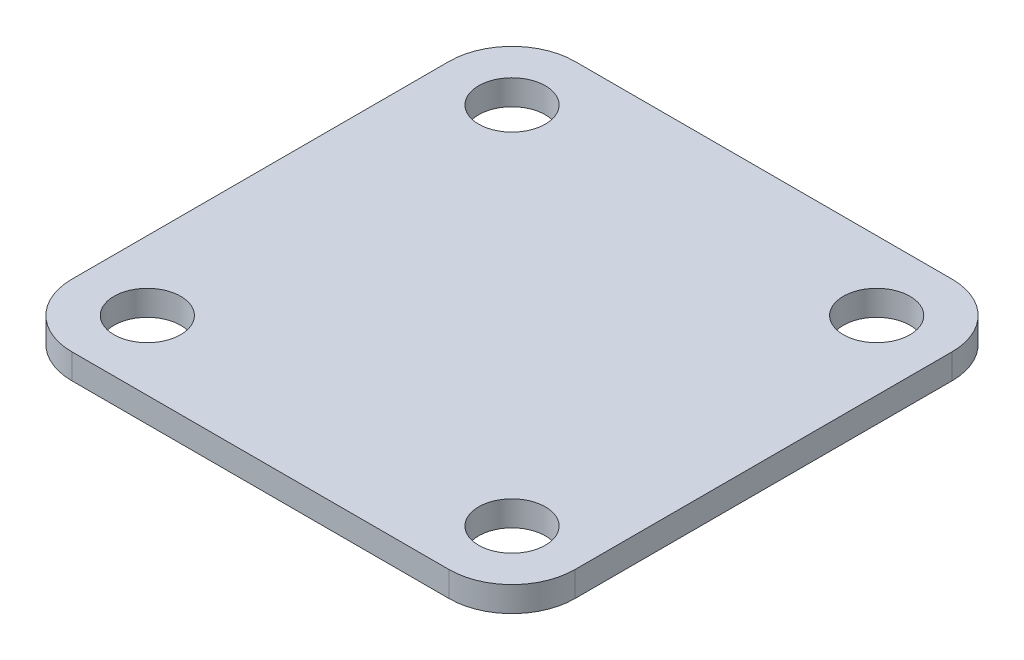
from build123d import *

# Parameters (mm, degrees)
SKETCH1_R           = 2.65
BOSS_EXTRUDE1_DEPTH = 2
SKETCH4_R           = 15
BOSS_EXTRUDE2_DEPTH = 3
FILLET1_R           = 2
FILLET2_R           = 1


# Read off the part's stored shape, not the designer's step: Shell2
with BuildPart() as part:
    # Sketch1 → Boss-Extrude1 (new body)
    with BuildSketch(Plane(origin=(0, 0, 0), x_dir=(1, 0, 0), z_dir=(0, 1, 0))):
        with BuildLine():
            Line((5, 0), (35, 0))
            ThreePointArc((35, 0), (38.535533906, 1.464466094), (40, 5))
            Line((40, 5), (40, 35))
            ThreePointArc((40, 35), (38.535533906, 38.535533906), (35, 40))
            Line((35, 40), (5, 40))
            ThreePointArc((5, 40), (1.464466094, 38.535533906), (0, 35))
            Line((0, 35), (0, 5))
            ThreePointArc((0, 5), (1.464466094, 1.464466094), (5, 0))
        make_face()
        with Locations(Location((5.5, 34.5, 0), (0, 0, 270))):
            Circle(SKETCH1_R, mode=Mode.SUBTRACT)
        with Locations(Location((34.5, 34.5, 0), (0, 0, 270))):
            Circle(SKETCH1_R, mode=Mode.SUBTRACT)
        with Locations(Location((34.5, 5.5, 0), (0, 0, 270))):
            Circle(SKETCH1_R, mode=Mode.SUBTRACT)
        with Locations(Location((5.5, 5.5, 0), (0, 0, 270))):
            Circle(SKETCH1_R, mode=Mode.SUBTRACT)
    extrude(amount=BOSS_EXTRUDE1_DEPTH)

    # Sketch4 → Boss-Extrude2 (add)
    with BuildSketch(Plane.XZ):
        with Locations(Location((20, -20, 0), (0, 0, 270))):
            Circle(SKETCH4_R)
    extrude(amount=BOSS_EXTRUDE2_DEPTH)

    # Fillet1
    fillet1_edges = [part.edges().sort_by_distance(p)[0] for p in [
        (20, -3, -5),
    ]]
    fillet(fillet1_edges, radius=FILLET1_R)

    # Fillet2
    fillet2_edges = [part.edges().sort_by_distance(p)[0] for p in [
        (20, 0, -5),
    ]]
    fillet(fillet2_edges, radius=FILLET2_R - 0.0001)  # a hair under: the kernel refuses the full size

    # Shell2 outline → Shell2 (revolve, cut)
    with BuildSketch(Plane(origin=(20, 0, -20), x_dir=(1, 0, 0), z_dir=(0, 0, 1))):
        with BuildLine():
            Line((0, -3), (11.968871126, -3))
            ThreePointArc((11.968871126, -3), (11.68272329, -2.269299733), (11.527864045, -1.5))
            Line((11.527864045, -1.5), (0, -1.5))
            Line((0, -1.5), (0, -3))
        make_face()
    revolve(axis=Axis((20, 0, -20), (0, 1, 0)), mode=Mode.SUBTRACT)


solid = part.part
